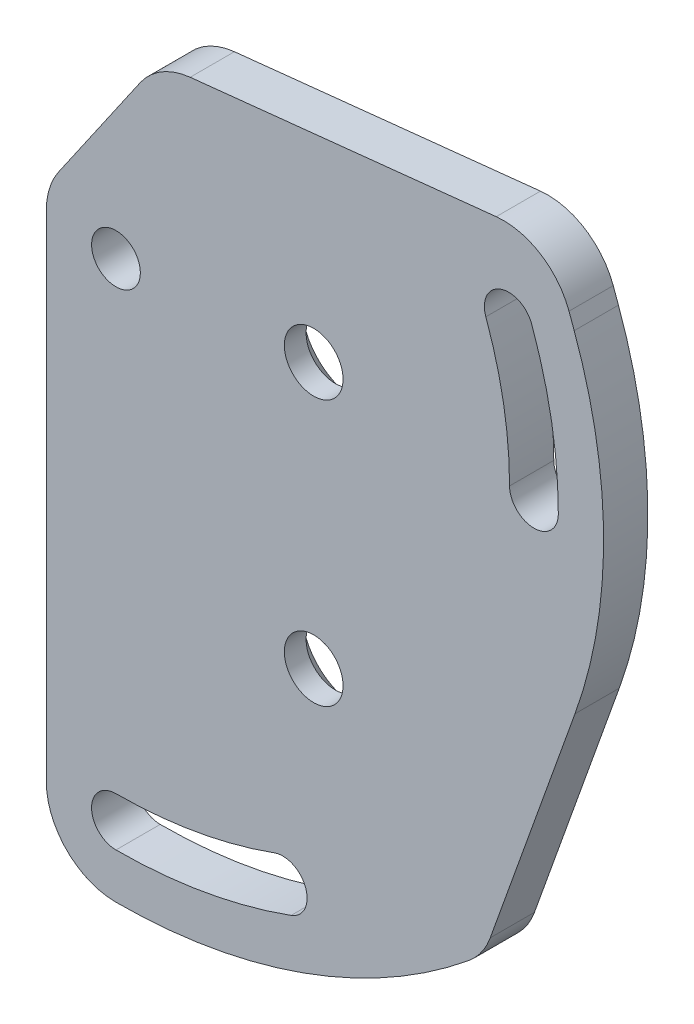
from build123d import *

# Parameters (mm, degrees)
BOSS_EXTRUDE1_DEPTH                          = 6.35
SKETCH3_R                                    = 3.5
CUT_EXTRUDE2_DEPTH                           = 139.002460895
SKETCH4_OUTSIDE_W                            = 133.666
SKETCH4_OUTSIDE_H                            = 145.76
CUT_EXTRUDE3_DEPTH                           = 139.002460895
FILLET1_R                                    = 10
CSK_FOR_5_16_FLAT_HEAD_MACHINE_SCREW_2_COUNT = 2
CSK_FOR_5_16_FLAT_HEAD_MACHINE_SCREW_2_PITCH = 38.1


with BuildPart() as part:
    # Sketch2 → Boss-Extrude1 (new body)
    with BuildSketch(Plane.XY):
        with BuildLine():
            Line((-10, -10), (-10, 103.338336241))
            Line((-10, 103.338336241), (62.358282022, 103.338336241))
            Line((62.358282022, 103.338336241), (91.244424357, 23.974312441))
            ThreePointArc((91.244424357, 23.974312441), (79.259842401, 5.488091998), (63.591736031, -10))
            Line((63.591736031, -10), (-10, -10))
        make_face()
    extrude(amount=BOSS_EXTRUDE1_DEPTH)

    # Sketch3 → Cut-Extrude2 (cut, through all)
    with BuildSketch(Plane.XY):
        with Locations((0, 70)):
            Circle(SKETCH3_R)
        with BuildLine():
            ThreePointArc((53.092633074, 89.324138098), (55.641638045, 79.811122038), (56.5, 70))
            ThreePointArc((56.5, 70), (60, 66.5), (63.5, 70))
            ThreePointArc((63.5, 70), (62.535292316, 81.026659282), (59.67048142, 91.718279101))
            ThreePointArc((59.67048142, 91.718279101), (55.184486746, 93.810132772), (53.092633074, 89.324138098))
        make_face()
        with BuildLine():
            ThreePointArc((77.273680119, 26.460819381), (68.539219913, 13.703843633), (57.722230193, 2.657398108))
            ThreePointArc((57.722230193, 2.657398108), (57.342601892, -2.277769807), (62.277769807, -2.657398108))
            ThreePointArc((62.277769807, -2.657398108), (73.948455322, 9.260852265), (83.372254441, 23.024630908))
            ThreePointArc((83.372254441, 23.024630908), (82.041061517, 27.792012306), (77.273680119, 26.460819381))
        make_face()
        with BuildLine():
            ThreePointArc((22.744339531, 7.510440718), (11.547603815, 4.510284425), (0, 3.5))
            ThreePointArc((0, 3.5), (-3.5, 0), (0, -3.5))
            ThreePointArc((0, -3.5), (12.763141059, -2.383369846), (25.138480534, 0.932592372))
            ThreePointArc((25.138480534, 0.932592372), (27.230334206, 5.418587047), (22.744339531, 7.510440718))
        make_face()
    extrude(amount=CUT_EXTRUDE2_DEPTH, mode=Mode.SUBTRACT)

    # Sketch4 outside → Cut-Extrude3 (cut, through all)
    with BuildSketch(Plane.XY):
        with Locations((40.622, 46.669)):
            Rectangle(SKETCH4_OUTSIDE_W, SKETCH4_OUTSIDE_H)
        with BuildLine():
            Line((65.893010444, 46.375623296), (52.822036509, 9.918118713))
            ThreePointArc((52.822036509, 9.918118713), (28.226313052, -4.855028231), (0, -10))
            Line((0, -10), (-10, -10))
            Line((-10, -10), (-10, 74.111503744))
            Line((-10, 74.111503744), (6.084489401, 97.400118036))
            Line((6.084489401, 97.400118036), (62.358282022, 103.338336241))
            Line((62.358282022, 103.338336241), (65.778483455, 93.941410033))
            ThreePointArc((65.778483455, 93.941410033), (69.999797095, 70.168542697), (65.893010444, 46.375623296))
        make_face(mode=Mode.SUBTRACT)
    extrude(amount=CUT_EXTRUDE3_DEPTH, mode=Mode.SUBTRACT)

    # Fillet1
    fillet1_edges = [part.edges().sort_by_distance(p)[0] for p in [
        (52.822036509, 9.918118713, 3.175),
        (-10, -10, 3.175),
        (-10, 74.111503744, 3.175),
        (62.358282022, 103.338336241, 3.175),
        (6.084489401, 97.400118036, 3.175),
    ]]
    fillet(fillet1_edges, radius=FILLET1_R - 0.0001)  # a hair under: the kernel refuses the full size

    # Sketch9 → CSK for 5_16 Flat Head Machine Screw _10 (revolve, cut)
    with BuildSketch(Plane(origin=(28.384975395, 71.315714753, 0), x_dir=(0, 1, 0), z_dir=(1, 0, 0))):
        Polygon((0, 0), (0, 6.35), (4.2164, 6.35), (4.2164, 3.228939291), (8.0645, 0), align=None)
    csk_for_5_16_flat_head_machine_screw_10 = revolve(axis=Axis((28.384975395, 71.315714753, -6.35), (0, 0, 1)), mode=Mode.SUBTRACT)

    # CSK for 5_16 Flat Head Machine Screw 2: CSK for 5_16 Flat Head Machine Screw _10 ×2
    with Locations(*[(0, -i * CSK_FOR_5_16_FLAT_HEAD_MACHINE_SCREW_2_PITCH, 0) for i in range(1, CSK_FOR_5_16_FLAT_HEAD_MACHINE_SCREW_2_COUNT)]):
        add(csk_for_5_16_flat_head_machine_screw_10, mode=Mode.SUBTRACT)


solid = part.part
